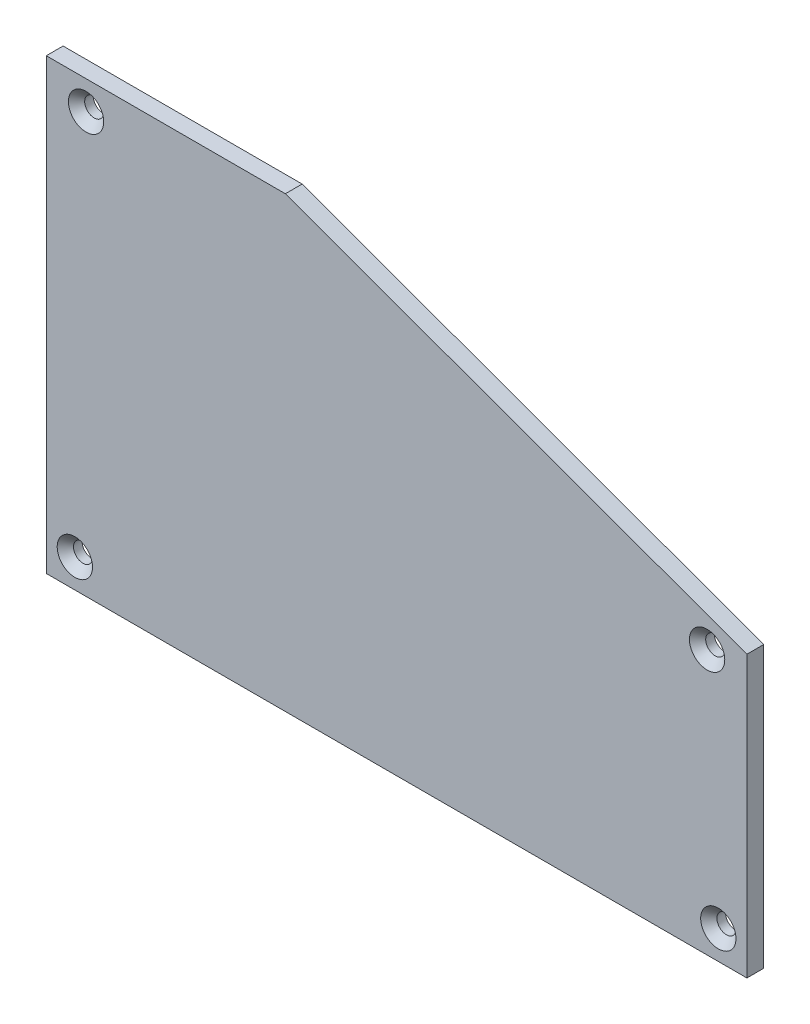
from build123d import *

# Parameters (mm, degrees)
EXTRUDE_1_DEPTH            = 3
HOLE_WIZARD_M31_AT_2_COUNT = 2
HOLE_WIZARD_M31_AT_2_PITCH = 69.828647416
HOLE_WIZARD_M31_AT_3_COUNT = 2
HOLE_WIZARD_M31_AT_3_PITCH = 114.213472497
HOLE_WIZARD_M31_AT_4_COUNT = 2
HOLE_WIZARD_M31_AT_4_PITCH = 132.649462871


with BuildPart() as part:
    # Эскиз1 → Бобышка-Вытянуть1 (new body)
    with BuildSketch(Plane.XY):
        Polygon((-11.094891825, 74), (71.25, 44.028910432), (71.25, -6), (-53.75, -6), (-53.75, 74), align=None)
    extrude(amount=EXTRUDE_1_DEPTH)

    # Эскиз5 → Зенковка для винта с потайной головкой M31 (revolve, cut)
    with BuildSketch(Plane(origin=(-46.65, 68.9, 3), x_dir=(0, -1, 0), z_dir=(1, 0, 0))):
        Polygon((0, 0), (0, 3), (1.7, 3), (1.7, 1.45), (3.15, 0), align=None)
    hole_wizard_m31 = revolve(axis=Axis((-46.65, 68.9, 9.35), (0, 0, -1)), mode=Mode.SUBTRACT)

    # Зенковка для винта с потайной головкой M31 at 2: Зенковка для винта с потайной головкой M31 ×2
    with Locations(*[Vector(-0.0286415400268957, -0.9995897469386568, 0) * (i * HOLE_WIZARD_M31_AT_2_PITCH) for i in range(1, HOLE_WIZARD_M31_AT_2_COUNT)]):
        add(hole_wizard_m31, mode=Mode.SUBTRACT)

    # Зенковка для винта с потайной головкой M31 at 3: Зенковка для винта с потайной головкой M31 ×2
    with Locations(*[Vector(0.9701132237525701, -0.2426527005833562, 0) * (i * HOLE_WIZARD_M31_AT_3_PITCH) for i in range(1, HOLE_WIZARD_M31_AT_3_COUNT)]):
        add(hole_wizard_m31, mode=Mode.SUBTRACT)

    # Зенковка для винта с потайной головкой M31 at 4: Зенковка для винта с потайной головкой M31 ×2
    with Locations(*[Vector(0.8503615284864277, -0.5261988890811407, 0) * (i * HOLE_WIZARD_M31_AT_4_PITCH) for i in range(1, HOLE_WIZARD_M31_AT_4_COUNT)]):
        add(hole_wizard_m31, mode=Mode.SUBTRACT)


solid = part.part
